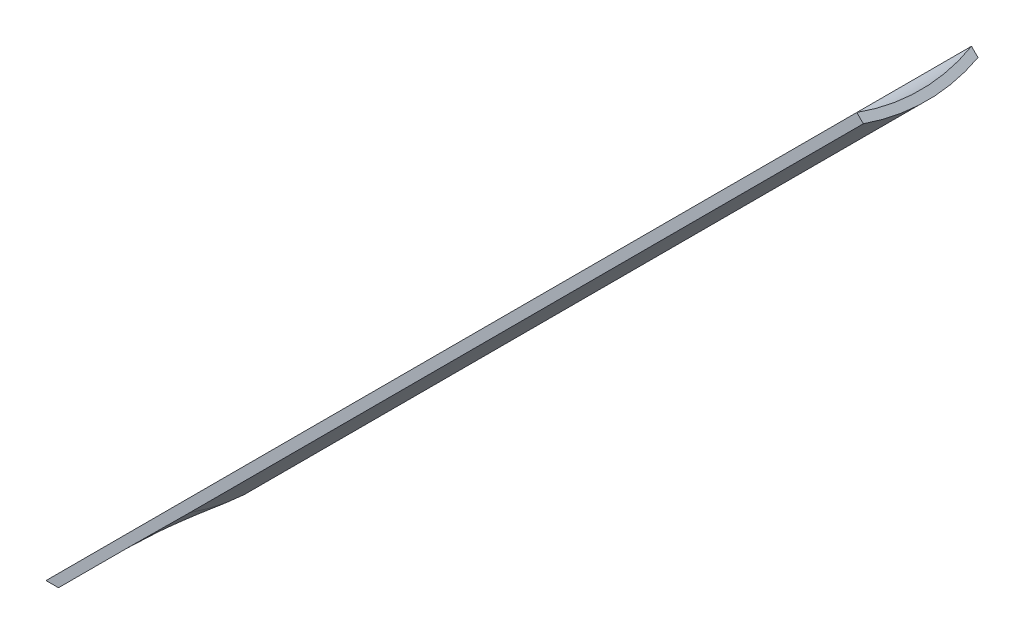
from build123d import *

# Parameters (mm, degrees)
BOSS_EXTRUDE1_DEPTH = 6.5
BOSS_EXTRUDE2_DEPTH = 54


with BuildPart() as part:
    # Sketch1 → Boss-Extrude1 (new body)
    with BuildSketch(Plane.XY):
        Polygon((0.353553391, 0), (-0.353553391, 0), (3.889087297, 4.242640687), (4.242640687, 3.889087297), align=None)
    extrude(amount=BOSS_EXTRUDE1_DEPTH)

    # Sketch2 → Loft1 section 0
    with BuildSketch(Plane(origin=(4.065863992, 4.065863992, 0), x_dir=(0, 0, -1), z_dir=(0.707106781186551, 0.7071067811865441, 0))):
        with BuildLine():
            Line((0, -0.25), (0, 0.25))
            Line((0, 0.25), (-6.5, 0.25))
            Line((-6.5, 0.25), (-6.5, -0.25))
            Line((-6.5, -0.25), (0, -0.25))
        make_face()
    # Sketch3 for Loft1 → Loft1 section 1
    with BuildSketch(Plane(origin=(7.601397898, 7.601397898, 0), x_dir=(0, 0, -1), z_dir=(0.7071067811865509, 0.7071067811865441, 0))):
        with BuildLine():
            Line((-6.5, 0.25), (-6.5, -0.273096719))
            # circular arc as an exact rational Bezier (weights 1, cos(half-angle), 1)
            Bezier((-6.5, -0.273096719), (-3.25, -1.247893057), (0, -0.273096719), weights=[1, 0.957842804, 1])
            Line((0, -0.273096719), (0, 0.25))
            Bezier((0, 0.25), (-3.25, -0.774242424), (-6.5, 0.25), weights=[1, 0.953757225, 1])
        make_face()
    loft()

    # Sketch4 → Boss-Extrude2 (add)
    with BuildSketch(Plane(origin=(7.601397898, 7.601397898, 0), x_dir=(0, 0, -1), z_dir=(0.7071067811865509, 0.7071067811865441, 0))):
        with BuildLine():
            Line((-6.5, 0.25), (-6.5, -0.273096719))
            ThreePointArc((-6.5, -0.273096719), (-3.25, -0.75), (0, -0.273096719))
            Line((0, -0.273096719), (0, 0.25))
            ThreePointArc((0, 0.25), (-3.25, -0.25), (-6.5, 0.25))
        make_face()
    extrude(amount=BOSS_EXTRUDE2_DEPTH)


solid = part.part
